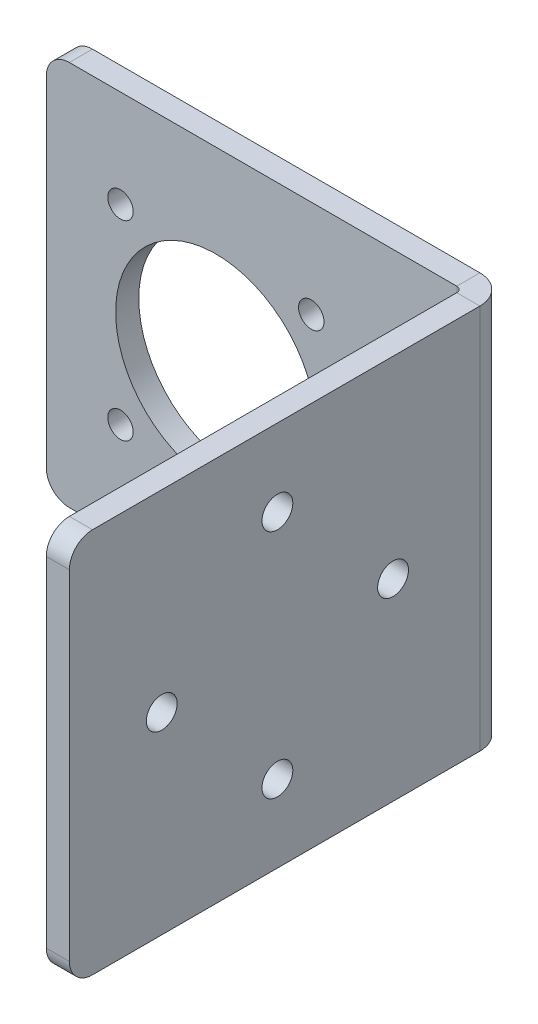
from build123d import *

# Parameters (mm, degrees)
SKETCH_2_W             = 110
SKETCH_2_H             = 50
SM_BASE_FLANGE_1_DEPTH = 3
OTHER_START            = -25
OTHER_1_DEPTH          = 50
OTHER_1_2_DEPTH        = 50
SKETCH_8_R             = 2
CUT_EXTRUDE_1_DEPTH    = 10
FILLET_1_R             = 3
SKETCH_9_R             = 13
CUT_EXTRUDE_2_DEPTH    = 10
SKETCH_10_R            = 1.65
CUT_EXTRUDE_3_DEPTH    = 82.01751709


# Read off the part's stored shape, not the designer's step: 绘制的折弯1
# Sheet-metal steps are written as plain solids
with BuildPart() as part:
    # Sketch 2 → 基体-法兰1 (new body)
    with BuildSketch(Plane.XY):
        Rectangle(SKETCH_2_W, SKETCH_2_H)
    extrude(amount=-SM_BASE_FLANGE_1_DEPTH)

    # Other 1 outline → Other 1 (cut)
    with BuildSketch(Plane(origin=(0, 0, 0), x_dir=(1, 0, 0), z_dir=(0, 1, 0)).offset(OTHER_START)):
        with BuildLine():
            ThreePointArc((-1.756621532, 3), (0.610845469, 2.154295979), (1.906655689, 0))
            Line((1.906655689, 0), (55, 0))
            Line((55, 0), (55, 3))
            Line((55, 3), (-1.756621532, 3))
        make_face()
    extrude(amount=OTHER_1_DEPTH, mode=Mode.SUBTRACT)

    # Other 1 2 outline → Other 1 2 (add)
    with BuildSketch(Plane(origin=(0, 0, 0), x_dir=(1, 0, 0), z_dir=(0, 1, 0)).offset(OTHER_START)):
        with BuildLine():
            Line((-1.020021532, -0.7366), (-1.020021532, -53.979978468))
            Line((-1.020021532, -53.979978468), (1.979978468, -53.979978468))
            Line((1.979978468, -53.979978468), (1.979978468, -0.7366))
            ThreePointArc((1.979978468, -0.7366), (1.961602589, -0.36647982), (1.906655689, 0))
            Line((1.906655689, 0), (-1.756621532, 0))
            ThreePointArc((-1.756621532, 0), (-1.235766677, -0.215745145), (-1.020021532, -0.7366))
        make_face()
    extrude(amount=OTHER_1_2_DEPTH)

    # 草图8 → 切除-拉伸1 (cut)
    with BuildSketch(Plane.ZY.offset(1.020021532)):
        with Locations((12, 0)):
            Circle(SKETCH_8_R)
        with Locations((42, 0)):
            Circle(SKETCH_8_R)
        with Locations((27, 15)):
            Circle(SKETCH_8_R)
        with Locations((27, -15)):
            Circle(SKETCH_8_R)
    extrude(amount=-CUT_EXTRUDE_1_DEPTH, mode=Mode.SUBTRACT)

    # 圆角1
    fillet_1_edges = [part.edges().sort_by_distance(p)[0] for p in [
        (-55, -25, -1.5),
        (-55, 25, -1.5),
        (0.479978468, -25, 53.979978468),
        (0.479978468, 25, 53.979978468),
    ]]
    fillet(fillet_1_edges, radius=FILLET_1_R)

    # 草图9 → 切除-拉伸2 (cut)
    with BuildSketch(Plane.XY):
        with Locations((-33, 0)):
            Circle(SKETCH_9_R)
    extrude(amount=-CUT_EXTRUDE_2_DEPTH, mode=Mode.SUBTRACT)

    # 草图10 → 切除-拉伸3 (cut, through all)
    with BuildSketch(Plane.XY):
        with Locations((-20.625631329, 12.374368671)):
            Circle(SKETCH_10_R)
        with Locations((-20.625631329, -12.374368671)):
            Circle(SKETCH_10_R)
        with Locations((-45.374368671, -12.374368671)):
            Circle(SKETCH_10_R)
        with Locations((-45.374368671, 12.374368671)):
            Circle(SKETCH_10_R)
    extrude(amount=-CUT_EXTRUDE_3_DEPTH, mode=Mode.SUBTRACT)


solid = part.part
